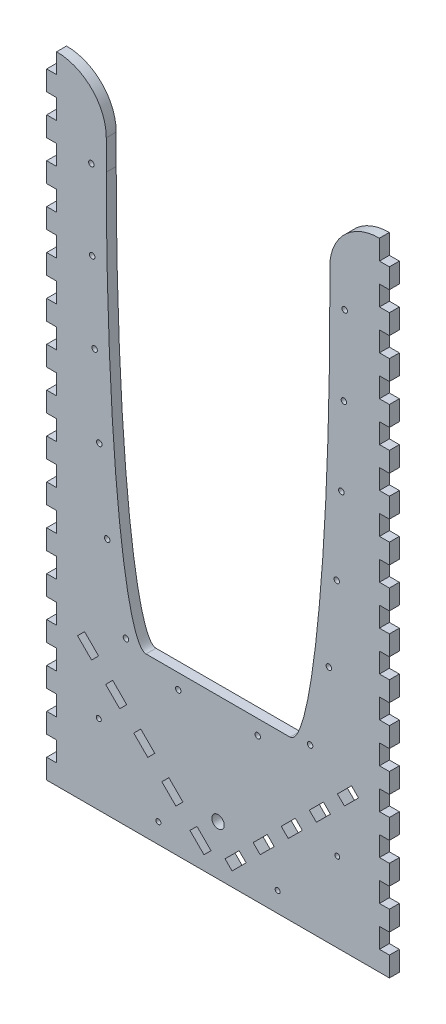
from build123d import *

# Parameters (mm, degrees)
BOSS_EXTRUDE1_DEPTH   = 6.35
SKETCH2_R             = 3.96875
SKETCH2_R_2           = 1.5875
CUT_EXTRUDE1_DEPTH    = 462.730590415
BOSS_EXTRUDE2_DEPTH   = 6.35
FILLET1_R             = 31.75
SKETCH6_W             = 6.35
SKETCH6_H             = 12.7
CUT_EXTRUDE3_DEPTH    = 462.730590552
LPATTERN1_COUNT       = 16
LPATTERN1_PITCH       = 25.4
SKETCH7_R             = 1.75
CUT_EXTRUDE4_DEPTH    = 462.730590552
CRVPATTERN3_OUTLINE_R = 1.75
CRVPATTERN3_DEPTH     = 6.35
SKETCH9_R             = 1.75
CUT_EXTRUDE5_DEPTH    = 462.730590552
CUT_EXTRUDE6_DEPTH    = 462.730590552
LPATTERN2_COUNT       = 5
LPATTERN2_PITCH       = 25.4
CUT_EXTRUDE7_DEPTH    = 462.730590552
LPATTERN3_COUNT       = 5
LPATTERN3_PITCH       = 25.4
SKETCH13_R            = 1.5875
CUT_EXTRUDE8_DEPTH    = 462.730590552


# Read off the part's stored shape, not the designer's step: CrvPattern3
with BuildPart() as part:
    # Sketch1 → Boss-Extrude1 (new body)
    with BuildSketch(Plane.XY):
        Polygon((0, 406.4), (0, 0), (219.075, 0), (219.075, 406.4), (180.975, 406.4), (180.975, 101.6), (38.1, 101.6), (38.1, 406.4), align=None)
    extrude(amount=BOSS_EXTRUDE1_DEPTH)

    # Sketch2 → Cut-Extrude1 (cut, through all)
    with BuildSketch(Plane.XY.offset(6.35)):
        with Locations((109.5375, 31.75)):
            Circle(SKETCH2_R)
        with Locations((71.4375, 12.7)):
            Circle(SKETCH2_R_2)
        with Locations((147.6375, 12.7)):
            Circle(SKETCH2_R_2)
    extrude(amount=-CUT_EXTRUDE1_DEPTH, mode=Mode.SUBTRACT)

    # Sketch4 → Boss-Extrude2 (add, through all)
    with BuildSketch(Plane.XY.offset(6.35)):
        with BuildLine():
            Line((38.1, 355.6), (38.1, 101.6))
            Line((38.1, 101.6), (63.5, 101.6))
            add(Edge.make_bspline(
                [(38.1, 355.6), (38.1, 101.6), (63.5, 101.6)],
                knots=[4.71238898, 4.71238898, 4.71238898, 6.283185307, 6.283185307, 6.283185307], degree=2, weights=[1, 0.707106781, 1]))
        make_face()
        with BuildLine():
            Line((180.975, 355.6), (180.975, 101.6))
            Line((180.975, 101.6), (155.575, 101.6))
            add(Edge.make_bspline(
                [(155.575, 101.6), (180.975, 101.6), (180.975, 355.6)],
                knots=[3.141592654, 3.141592654, 3.141592654, 4.71238898, 4.71238898, 4.71238898], degree=2, weights=[1, 0.707106781, 1]))
        make_face()
    extrude(amount=-BOSS_EXTRUDE2_DEPTH)

    # Fillet1
    fillet1_edges = [part.edges().sort_by_distance(p)[0] for p in [
        (38.1, 406.4, 3.175),
        (180.975, 406.4, 3.175),
    ]]
    fillet(fillet1_edges, radius=FILLET1_R)

    # Sketch6 → Cut-Extrude3 (cut, through all)
    with BuildSketch(Plane.XY.offset(6.35)):
        with Locations((3.175, 400.05)):
            Rectangle(SKETCH6_W, SKETCH6_H)
        with Locations((215.9, 400.05)):
            Rectangle(SKETCH6_W, SKETCH6_H)
    cut_extrude3 = extrude(amount=-CUT_EXTRUDE3_DEPTH, mode=Mode.SUBTRACT)

    # LPattern1: Cut-Extrude3 ×16
    with Locations(*[(0, -i * LPATTERN1_PITCH, 0) for i in range(1, LPATTERN1_COUNT)]):
        add(cut_extrude3, mode=Mode.SUBTRACT)

    # Sketch7 → Cut-Extrude4 (cut, through all)
    with BuildSketch(Plane.XY.offset(6.35)):
        with Locations((28.575, 355.6)):
            Circle(SKETCH7_R)
    cut_extrude4 = extrude(amount=-CUT_EXTRUDE4_DEPTH, mode=Mode.SUBTRACT)

    # CrvPattern3 outline → CrvPattern3 (cut)
    with BuildSketch(Plane.XY):
        with Locations((29.088113328, 304.803472764)):
            Circle(CRVPATTERN3_OUTLINE_R)
        with Locations((30.694206296, 254.030002215)):
            Circle(CRVPATTERN3_OUTLINE_R)
        with Locations((33.646164376, 203.317879517)):
            Circle(CRVPATTERN3_OUTLINE_R)
        with Locations((38.685113302, 152.775108831)):
            Circle(CRVPATTERN3_OUTLINE_R)
        with Locations((50.68611396, 103.738286233)):
            Circle(CRVPATTERN3_OUTLINE_R)
    crvpattern3 = extrude(amount=CRVPATTERN3_DEPTH, mode=Mode.SUBTRACT)

    # Mirror1: Cut-Extrude4, CrvPattern3 across plane
    add(cut_extrude4.mirror(Plane(origin=(109.5375, 0, 0), x_dir=(0, 0, 1), z_dir=(1, 0, 0))), mode=Mode.SUBTRACT)
    add(crvpattern3.mirror(Plane(origin=(109.5375, 0, 0), x_dir=(0, 0, 1), z_dir=(1, 0, 0))), mode=Mode.SUBTRACT)

    # Sketch9 → Cut-Extrude5 (cut, through all)
    with BuildSketch(Plane.XY.offset(6.35)):
        with Locations((134.9375, 92.075)):
            Circle(SKETCH9_R)
        with Locations((84.1375, 92.075)):
            Circle(SKETCH9_R)
    extrude(amount=-CUT_EXTRUDE5_DEPTH, mode=Mode.SUBTRACT)

    # Sketch10 → Cut-Extrude6 (cut, through all)
    with BuildSketch(Plane(origin=(0, 0, 0), x_dir=(-1, 0, 0), z_dir=(0, 0, -1))):
        Polygon((-199.340061211, 89.802561211), (-190.35980509, 80.82230509), (-185.869677029, 85.31243315), (-194.84993315, 94.292689271), align=None)
    cut_extrude6 = extrude(amount=-CUT_EXTRUDE6_DEPTH, mode=Mode.SUBTRACT)

    # LPattern2: Cut-Extrude6 ×5
    with Locations(*[Vector(-0.7071067811865492, -0.7071067811865458, 0) * (i * LPATTERN2_PITCH) for i in range(1, LPATTERN2_COUNT)]):
        add(cut_extrude6, mode=Mode.SUBTRACT)

    # Sketch11 → Cut-Extrude7 (cut, through all)
    with BuildSketch(Plane(origin=(0, 0, 0), x_dir=(-1, 0, 0), z_dir=(0, 0, -1))):
        Polygon((-19.734938789, 89.802561211), (-28.71519491, 80.82230509), (-33.205322971, 85.31243315), (-24.22506685, 94.292689271), align=None)
    cut_extrude7 = extrude(amount=-CUT_EXTRUDE7_DEPTH, mode=Mode.SUBTRACT)

    # LPattern3: Cut-Extrude7 ×5
    with Locations(*[Vector(0.7071067811865434, -0.7071067811865517, 0) * (i * LPATTERN3_PITCH) for i in range(1, LPATTERN3_COUNT)]):
        add(cut_extrude7, mode=Mode.SUBTRACT)

    # Sketch13 → Cut-Extrude8 (cut, through all)
    with BuildSketch(Plane.XY.offset(6.35)):
        with Locations((33.3375, 50.8)):
            Circle(SKETCH13_R)
        with Locations((185.7375, 50.8)):
            Circle(SKETCH13_R)
    extrude(amount=-CUT_EXTRUDE8_DEPTH, mode=Mode.SUBTRACT)


solid = part.part
